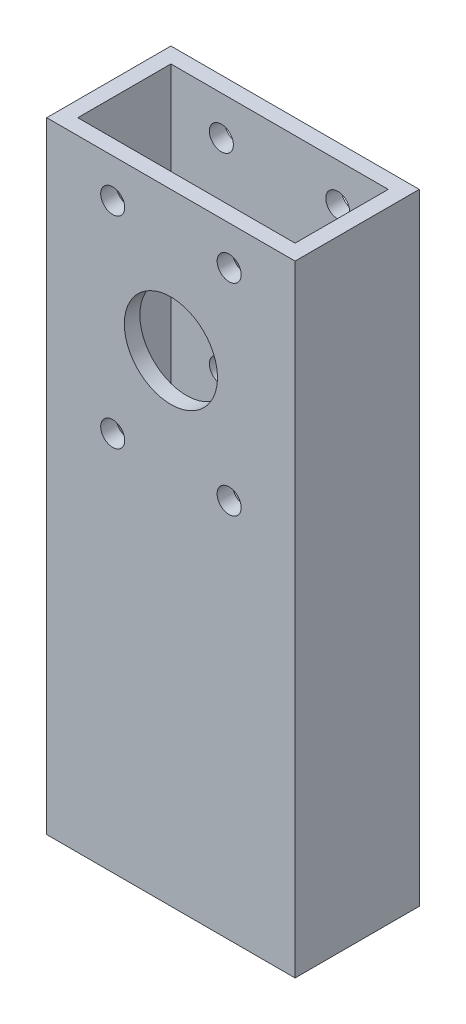
from build123d import *

# Parameters (mm, degrees)
SKETCH1_W                    = 50.8
SKETCH1_H                    = 25.4
SKETCH1_W_2                  = 44.45
SKETCH1_H_2                  = 19.05
EXTRUDE_THIN1_DEPTH          = 127
F_10_0_1935_DIAMETER_HOLE2_D = 4.9149
CUT_EXTRUDE2_DEPTH           = 132.982271537
CUT_EXTRUDE2_DEPTH_BACK      = 132.982271537
SKETCH7_R                    = 9.525


with BuildPart() as part:
    # Sketch1 → Extrude-Thin1 (new body)
    with BuildSketch(Plane(origin=(0, 0, 0), x_dir=(1, 0, 0), z_dir=(0, 1, 0))):
        Rectangle(SKETCH1_W, SKETCH1_H)
        Rectangle(SKETCH1_W_2, SKETCH1_H_2, mode=Mode.SUBTRACT)
    extrude(amount=EXTRUDE_THIN1_DEPTH)

    # #10 (0.1935) Diameter Hole2 (through all)
    with Locations(Plane(origin=(0, 0, -12.7), x_dir=(-1, 0, 0), z_dir=(0, 0, -1))):
        with Locations((-11.90625, 77.802770072), (-11.90625, 119.047229928), (11.90625, 119.047229928), (11.90625, 77.802770072)):
            Hole(F_10_0_1935_DIAMETER_HOLE2_D / 2)

    # Sketch7 → Cut-Extrude2 (cut, two sides: drawn at the far end of the back side and taken through both)
    with BuildSketch(Plane(origin=(0, 0, -12.7), x_dir=(-1, 0, 0), z_dir=(0, 0, -1)).offset(-CUT_EXTRUDE2_DEPTH_BACK)):
        with Locations((0, 98.425)):
            Circle(SKETCH7_R)
    extrude(amount=CUT_EXTRUDE2_DEPTH + CUT_EXTRUDE2_DEPTH_BACK, mode=Mode.SUBTRACT)


solid = part.part
